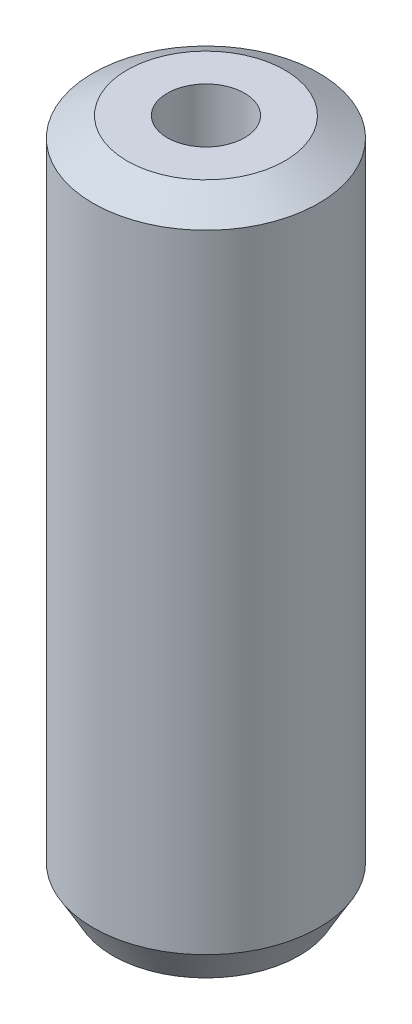
from build123d import *
from OCP.BRepFilletAPI import BRepFilletAPI_MakeChamfer

# Parameters (mm, degrees)
SKETCH1_R           = 17.5
BOSS_EXTRUDE1_DEPTH = 105.594713805
SKETCH2_R           = 5.992419487
CUT_EXTRUDE1_DEPTH  = 109.456182782
CHAMFER1_SIZE       = 3.044602271
CHAMFER1_SIZE2      = 5.273405822


with BuildPart() as part:
    # Sketch1 → Boss-Extrude1 (new body)
    with BuildSketch(Plane(origin=(0, 0, 0), x_dir=(1, 0, 0), z_dir=(0, 1, 0))):
        Circle(SKETCH1_R)
    extrude(amount=BOSS_EXTRUDE1_DEPTH)

    # Sketch2 → Cut-Extrude1 (cut, through all)
    with BuildSketch(Plane(origin=(0, 0, 0), x_dir=(1, 0, 0), z_dir=(0, 1, 0))):
        Circle(SKETCH2_R)
    extrude(amount=CUT_EXTRUDE1_DEPTH, mode=Mode.SUBTRACT)

    # Chamfer1: one chamfer whose edges measure the first distance from different faces: ONE call of the kernel's chamfer builder (chamfer() names one face for all edges)
    chamfer1_edges_1 = [part.edges().sort_by_distance(p)[0] for p in [
        (-17.5, 105.594713805, 0),
    ]]
    chamfer1_side_1 = [part.faces().sort_by_distance(p)[0] for p in [
        (-17.5, 52.797356903, 0),
    ]]
    chamfer1_edges_2 = [part.edges().sort_by_distance(p)[0] for p in [
        (-17.5, 0, 0),
    ]]
    chamfer1_side_2 = [part.faces().sort_by_distance(p)[0] for p in [
        (-17.005025253, 0, 0),
    ]]
    chamfer1 = BRepFilletAPI_MakeChamfer(part.part.solid().wrapped)
    for e in chamfer1_edges_1:
        chamfer1.Add(CHAMFER1_SIZE, CHAMFER1_SIZE2, e.wrapped, chamfer1_side_1[0].wrapped)  # the first distance lies on this face
    for e in chamfer1_edges_2:
        chamfer1.Add(CHAMFER1_SIZE, CHAMFER1_SIZE2, e.wrapped, chamfer1_side_2[0].wrapped)  # the first distance lies on this face
    add(Compound.cast(chamfer1.Shape()), mode=Mode.REPLACE)


solid = part.part
